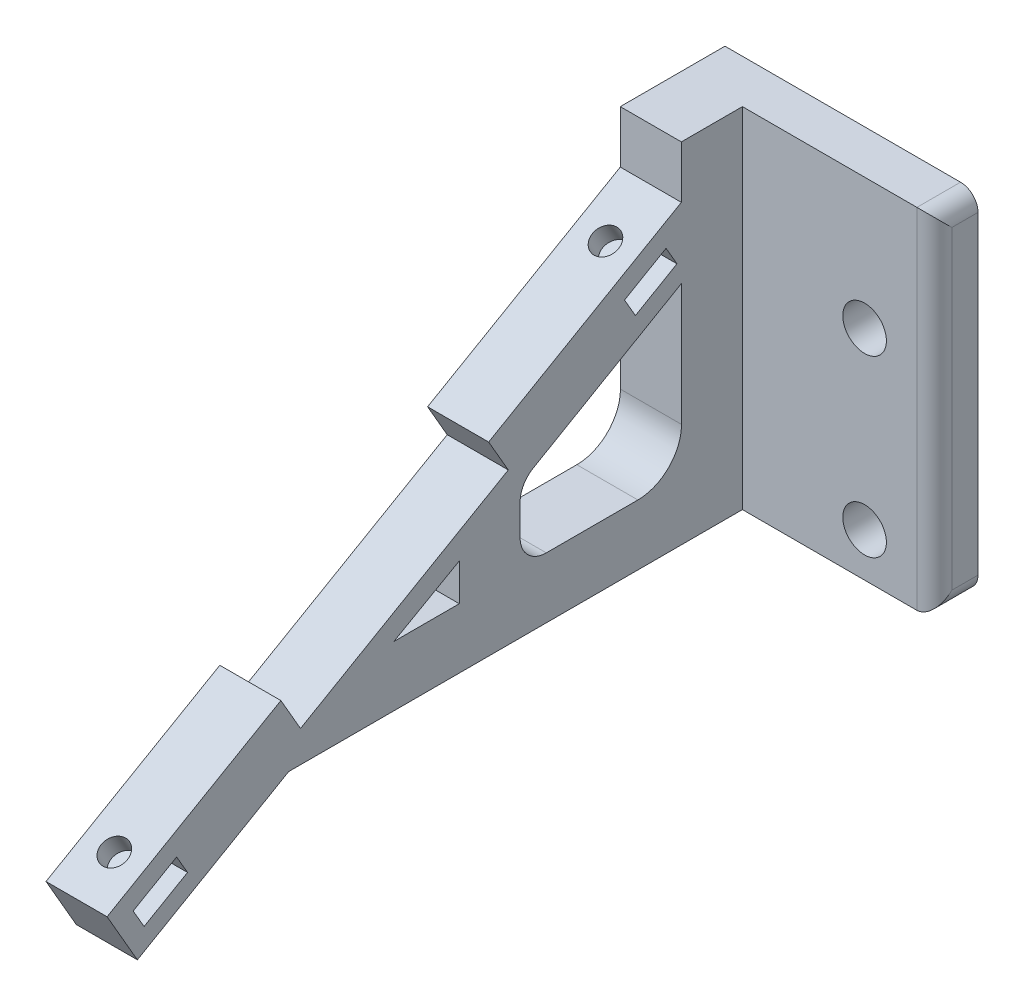
from build123d import *

# Parameters (mm, degrees)
BOSS_EXTRUDE1_DEPTH  = 7
SKETCH2_W            = 29
SKETCH2_H            = 40
SKETCH2_R            = 2.5
BOSS_EXTRUDE2_DEPTH  = 5
FILLET1_R            = 2
SKETCH3_R            = 1.5
CUT_EXTRUDE1_DEPTH   = 7.5
FILLET1_OF_MIRROR1_R = 2
SKETCH4_W            = 36.671322753
SKETCH4_H            = 72.42791828
CUT_EXTRUDE2_DEPTH   = 93.177168195


with BuildPart() as part:
    # Sketch1 → Boss-Extrude1 (new body)
    with BuildSketch(Plane(origin=(0, 0, 0), x_dir=(0, 0, -1), z_dir=(1, 0, 0))):
        Polygon((0, 0), (0, 40), (-7, 40), (-7, 34), (-29.083647797, 21.25), (-26.833647797, 17.352885683), (-50.649346401, 3.602885683), (-52.899346401, 7.5), (-72.817930688, -4), (-69.345498823, -10.014428415), (-52, 0), align=None)
        Polygon((-69.828328815, -4.926142338), (-64.848682743, -2.051142338), (-63.598682743, -4.216205848), (-68.578328815, -7.091205848), align=None, mode=Mode.SUBTRACT)
        Polygon((-39.949930688, 6.884), (-32.449930688, 11.134), (-32.449930688, 6.884), align=None, mode=Mode.SUBTRACT)
        with BuildLine():
            Line((-6.98, 25.947), (-6.98, 11.947))
            ThreePointArc((-6.98, 11.947), (-8.444466094, 8.411466094), (-11.98, 6.947))
            Line((-11.98, 6.947), (-22.48, 6.947))
            ThreePointArc((-22.48, 6.947), (-24.601320344, 7.825679656), (-25.48, 9.947))
            Line((-25.48, 9.947), (-25.48, 13.505607896))
            ThreePointArc((-25.48, 13.505607896), (-25.078135635, 15.007043949), (-23.98, 16.107))
            Line((-23.98, 16.107), (-6.98, 25.947))
        make_face(mode=Mode.SUBTRACT)
        Polygon((-13.512490144, 27.556681889), (-8.752389988, 30.311939862), (-7.5, 28.148257973), (-12.260100157, 25.393), align=None, mode=Mode.SUBTRACT)
    boss_extrude1 = extrude(amount=-BOSS_EXTRUDE1_DEPTH)

    # Sketch2 → Boss-Extrude2 (add)
    with BuildSketch(Plane(origin=(0, 0, 0), x_dir=(-1, 0, 0), z_dir=(0, 0, -1))):
        with Locations((14.5, 20)):
            Rectangle(SKETCH2_W, SKETCH2_H)
        with Locations((21, 25)):
            Circle(SKETCH2_R, mode=Mode.SUBTRACT)
        with Locations((21, 5)):
            Circle(SKETCH2_R, mode=Mode.SUBTRACT)
    boss_extrude2 = extrude(amount=BOSS_EXTRUDE2_DEPTH)

    # Fillet1
    fillet1_edges = [part.edges().sort_by_distance(p)[0] for p in [
        (-29, 0, -2.5),
        (-29, 20, 0),
        (-29, 40, -2.5),
    ]]
    fillet(fillet1_edges, radius=FILLET1_R)

    # Sketch3 → Cut-Extrude1 (cut)
    with BuildSketch(Plane(origin=(0, 28.531088913, 16.472431864), x_dir=(1, 0, 0), z_dir=(0, 0.8660254037844386, 0.4999999999999999))):
        with Locations((-3.5, 4.937822174)):
            Circle(SKETCH3_R)
        with Locations((-3.5, -60.062177826)):
            Circle(SKETCH3_R)
    cut_extrude1 = extrude(amount=-CUT_EXTRUDE1_DEPTH, mode=Mode.SUBTRACT)

    # Mirror1: Boss-Extrude1, Boss-Extrude2, Cut-Extrude1 across plane
    add(boss_extrude1.mirror(Plane(origin=(0, 0, 0), x_dir=(0, 0, 1), z_dir=(1, 0, 0))))
    add(boss_extrude2.mirror(Plane(origin=(0, 0, 0), x_dir=(0, 0, 1), z_dir=(1, 0, 0))))
    add(cut_extrude1.mirror(Plane(origin=(0, 0, 0), x_dir=(0, 0, 1), z_dir=(1, 0, 0))), mode=Mode.SUBTRACT)

    # Fillet1 of Mirror1
    fillet1_of_mirror1_edges = [part.edges().sort_by_distance(p)[0] for p in [
        (29, 0, -2.5),
        (29, 20, 0),
        (29, 40, -2.5),
    ]]
    fillet(fillet1_of_mirror1_edges, radius=FILLET1_OF_MIRROR1_R)

    # Sketch4 → Cut-Extrude2 (cut, through all)
    with BuildSketch(Plane(origin=(0, 0, -5), x_dir=(-1, 0, 0), z_dir=(0, 0, -1))):
        with Locations((18.335661377, 3.78604086)):
            Rectangle(SKETCH4_W, SKETCH4_H)
    extrude(amount=-CUT_EXTRUDE2_DEPTH, mode=Mode.SUBTRACT)


solid = part.part
